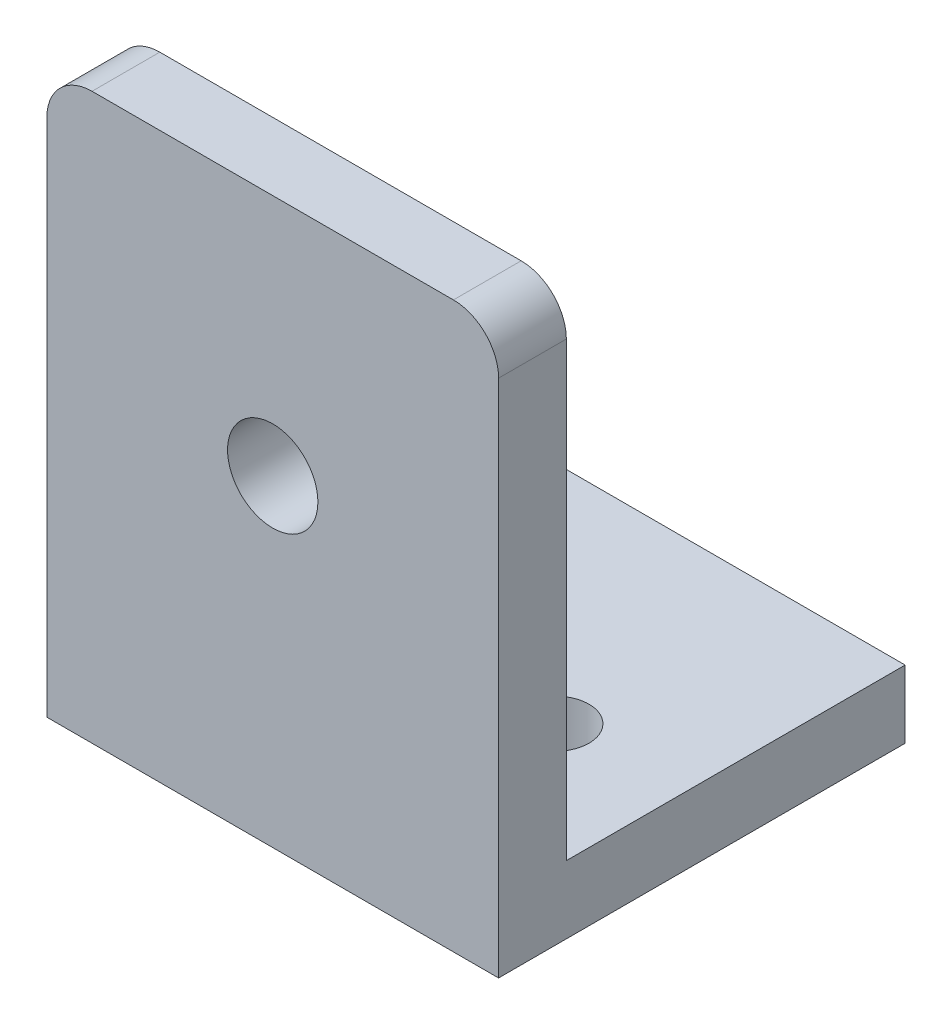
from build123d import *

# Parameters (mm, degrees)
EXTRUDE_1_DEPTH     = 20
SKETCH_2_R          = 1.5
CUT_EXTRUDE_1_DEPTH = 35.756294394
FILLET_1_R          = 2
SKETCH_3_R          = 2
CUT_EXTRUDE_2_DEPTH = 37.728735344


with BuildPart() as part:
    # 草图1 → 凸台-拉伸1 (new body)
    with BuildSketch(Plane(origin=(0, 0, 0), x_dir=(0, 0, -1), z_dir=(1, 0, 0))):
        Polygon((0, 0), (0, 25), (3, 25), (3, 3), (18, 3), (18, 0), align=None)
    extrude(amount=EXTRUDE_1_DEPTH)

    # 草图2 → 切除-拉伸1 (cut, through all)
    with BuildSketch(Plane(origin=(0, 3, 0), x_dir=(1, 0, 0), z_dir=(0, 1, 0))):
        with Locations((5.5, 8)):
            Circle(SKETCH_2_R)
        with Locations((14.5, 8)):
            Circle(SKETCH_2_R)
    extrude(amount=-CUT_EXTRUDE_1_DEPTH, mode=Mode.SUBTRACT)

    # 圆角1
    fillet_1_edges = [part.edges().sort_by_distance(p)[0] for p in [
        (0, 25, -1.5),
        (20, 25, -1.5),
    ]]
    fillet(fillet_1_edges, radius=FILLET_1_R)

    # 草图3 → 切除-拉伸2 (cut, through all)
    with BuildSketch(Plane.XY):
        with Locations((10, 14.25)):
            Circle(SKETCH_3_R)
    extrude(amount=-CUT_EXTRUDE_2_DEPTH, mode=Mode.SUBTRACT)


solid = part.part
